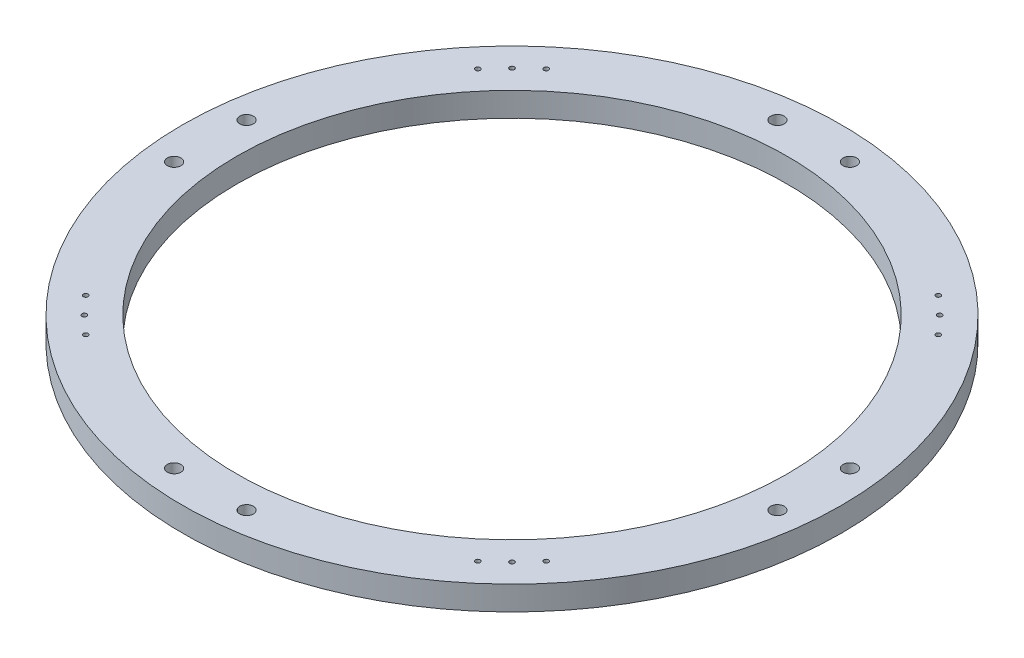
from build123d import *

# Parameters (mm, degrees)
SKETCH1_W                   = 28.575
SKETCH1_H                   = 12.7
TAP_DRILL_FOR_M3X0_5_TAP1_D = 2.5
SKETCH7_R                   = 3.571875
CUT_EXTRUDE1_DEPTH          = 246.499823847
CIRPATTERN1_COUNT           = 4


with BuildPart() as part:
    # Sketch1 → Revolve1 (revolve)
    with BuildSketch(Plane.XY):
        with Locations((159.074654908, 185.218849687)):
            Rectangle(SKETCH1_W, SKETCH1_H)
    revolve(axis=Axis((1e-09, -200000, 0), (0, 1, 0)))

    # Tap Drill for M3x0.5 Tap1 (through all)
    with Locations(Plane(origin=(0, 191.568849687, 0), x_dir=(1, 0, 0), z_dir=(0, 1, 0))):
        with Locations((-112.482767201, 112.482767201), (-103.143460893, 121.103973135), (-121.103973135, 103.143460893)):
            tap_drill_for_m3x0_5_tap1 = Hole(TAP_DRILL_FOR_M3X0_5_TAP1_D / 2)

    # Sketch7 → Cut-Extrude1 (cut, through all)
    with BuildSketch(Plane(origin=(0, 191.568849687, 0), x_dir=(1, 0, 0), z_dir=(0, 1, 0))):
        with Locations((158.674245572, -19.05)):
            Circle(SKETCH7_R)
        with Locations((158.674245572, 19.05)):
            Circle(SKETCH7_R)
    cut_extrude1 = extrude(amount=-CUT_EXTRUDE1_DEPTH, mode=Mode.SUBTRACT)

    # CirPattern1: Tap Drill for M3x0.5 Tap1, Cut-Extrude1 ×4 about axis
    cirpattern1_axis = Axis((1e-09, -200000, 0), (0, -1, 0))
    add([tap_drill_for_m3x0_5_tap1.rotate(cirpattern1_axis, i * 360 / CIRPATTERN1_COUNT) for i in range(1, CIRPATTERN1_COUNT)], mode=Mode.SUBTRACT)
    add([cut_extrude1.rotate(cirpattern1_axis, i * 360 / CIRPATTERN1_COUNT) for i in range(1, CIRPATTERN1_COUNT)], mode=Mode.SUBTRACT)


solid = part.part
